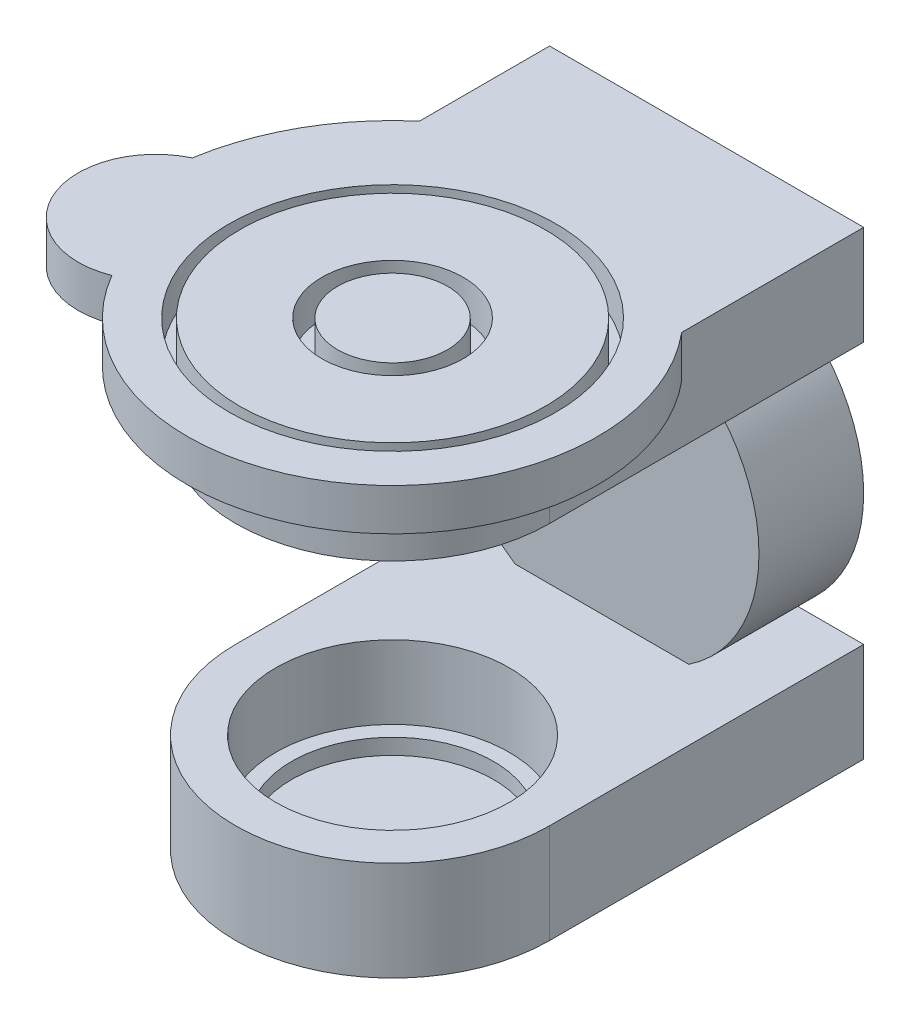
from build123d import *

# Parameters (mm, degrees)
SKETCH_335_R           = 15
EXTRUDE_380_DEPTH      = 10
EXTRUDE_START          = -2.5
EXTRUDE_822_DEPTH      = 9.5
SKETCH_883_R           = 9.65
CUT_EXTRUDE_1089_DEPTH = 8.5
SKETCH_4_3_R           = 11.15
SKETCH_4_3_R_2         = 9.65
CUT_EXTRUDE_1131_DEPTH = 7
CUT_EXTRUDE_1399_REACH = 66.699
SKETCH_1242_R          = 3.6
EXTRUDE_3_DEPTH        = 4
SKETCH_4_5_R           = 15.6
SKETCH_4_5_R_2         = 14.6
SKETCH_4_5_R_3         = 6.75
SKETCH_4_5_R_4         = 5.25
CUT_EXTRUDE_1_DEPTH    = 3.5


with BuildPart() as part:
    # Sketch 335 → Extrude 380 (new body)
    with BuildSketch(Plane.XY):
        Circle(SKETCH_335_R)
    extrude(amount=EXTRUDE_380_DEPTH)

    # Эскиз2 → Extrude 822 (add)
    with BuildSketch(Plane(origin=(0, -15, 0), x_dir=(-1, 0, 0), z_dir=(0, -1, 0)).offset(EXTRUDE_START)):
        with BuildLine():
            Line((15, -30), (15, 0))
            Line((15, 0), (-15, 0))
            Line((-15, 0), (-15, -30))
            ThreePointArc((-15, -30), (0, -45), (15, -30))
        make_face()
    extrude_822 = extrude(amount=EXTRUDE_822_DEPTH)

    # Sketch 883 → Cut-Extrude 1089 (cut)
    with BuildSketch(Plane(origin=(0, -12.5, 0), x_dir=(1, 0, 0), z_dir=(0, 1, 0))):
        with Locations((0, -30)):
            Circle(SKETCH_883_R)
    cut_extrude_1089 = extrude(amount=-CUT_EXTRUDE_1089_DEPTH, mode=Mode.SUBTRACT)

    # Эскиз4<3> → Cut-Extrude 1131 (cut)
    with BuildSketch(Plane(origin=(0, -12.5, 0), x_dir=(1, 0, 0), z_dir=(0, 1, 0))):
        with Locations((0, -30)):
            Circle(SKETCH_4_3_R)
        with Locations((0, -30)):
            Circle(SKETCH_4_3_R_2, mode=Mode.SUBTRACT)
    cut_extrude_1131 = extrude(amount=-CUT_EXTRUDE_1131_DEPTH, mode=Mode.SUBTRACT)

    # Зеркальное отражение2: Extrude 822, Cut-Extrude 1089, Cut-Extrude 1131 across plane
    add(extrude_822.mirror(Plane.ZX))
    add(cut_extrude_1089.mirror(Plane.ZX), mode=Mode.SUBTRACT)
    add(cut_extrude_1131.mirror(Plane.ZX), mode=Mode.SUBTRACT)

    # Sketch 1242 → Cut-Extrude 1399 (cut, up to next)
    with BuildSketch(Plane(origin=(0, 22, 0), x_dir=(1, 0, 0), z_dir=(0, 1, 0)), mode=Mode.PRIVATE) as cut_extrude_1399_sk1:
        with Locations((0, -30)):
            Circle(SKETCH_1242_R)
    cut_extrude_1399_tool1 = extrude(cut_extrude_1399_sk1.sketch, amount=-CUT_EXTRUDE_1399_REACH, mode=Mode.PRIVATE) & part.part
    add(cut_extrude_1399_tool1.solids().sort_by_distance((0, 22, 30))[0], mode=Mode.SUBTRACT)

    # Эскиз4 → Бобышка-Вытянуть3 (add)
    with BuildSketch(Plane(origin=(0, 22, 0), x_dir=(1, 0, 0), z_dir=(0, 1, 0))):
        with BuildLine():
            ThreePointArc((-16.921921975, -39.889820861), (11.29379909, -46.019054345), (15, -17.38413697))
            Line((15, -17.38413697), (15, -25.715142943))
            ThreePointArc((15, -25.715142943), (0, -14.4), (-15, -25.715142943))
            Line((-15, -25.715142943), (-15, -12.432700834))
            ThreePointArc((-15, -12.432700834), (-20.137369493, -18.682034198), (-22.804910758, -26.319504748))
            ThreePointArc((-22.804910758, -26.319504748), (-26.411442066, -35.943355833), (-16.921921975, -39.889820861))
        make_face()
    extrude(amount=-EXTRUDE_3_DEPTH)

    # Эскиз4<5> → Вырез-Вытянуть1 (cut)
    # profile 1 of 2: a face of its own
    with BuildSketch(Plane(origin=(0, 22, 0), x_dir=(1, 0, 0), z_dir=(0, 1, 0))):
        with Locations((0, -30)):
            Circle(SKETCH_4_5_R)
        with Locations((0, -30)):
            Circle(SKETCH_4_5_R_2, mode=Mode.SUBTRACT)
    # profile 2 of 2: a face of its own
    with BuildSketch(Plane(origin=(0, 22, 0), x_dir=(1, 0, 0), z_dir=(0, 1, 0))):
        with Locations((0, -30)):
            Circle(SKETCH_4_5_R_3)
        with Locations((0, -30)):
            Circle(SKETCH_4_5_R_4, mode=Mode.SUBTRACT)
    extrude(amount=-CUT_EXTRUDE_1_DEPTH, mode=Mode.SUBTRACT)


solid = part.part
